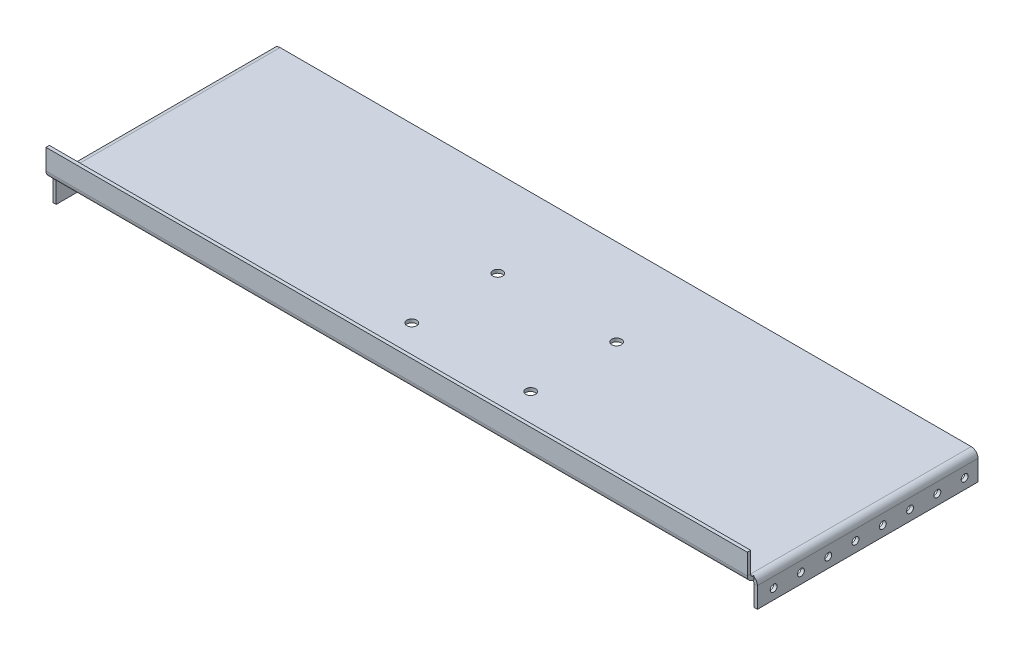
from build123d import *

# Parameters (mm, degrees)
SKETCH1_W                    = 489.688000048
SKETCH1_H                    = 177.8
BASE_FLANGE1_DEPTH           = 2.3622
EDGE_FLANGE1_STRIP_W         = 14.1688
EDGE_FLANGE1_STRIP_H         = 2.3622
EDGE_FLANGE1_STRIP_CUT_DEPTH = 489.688000048
EDGE_FLANGE1_DEPTH           = 489.688000048
EDGE_FLANGE2_STRIP_W         = 14.1688
EDGE_FLANGE2_STRIP_H         = 2.3622
EDGE_FLANGE2_STRIP_CUT_DEPTH = 173.0778
EDGE_FLANGE2_DEPTH           = 173.0778
EDGE_FLANGE3_STRIP_W         = 14.1688
EDGE_FLANGE3_STRIP_H         = 2.3622
EDGE_FLANGE3_STRIP_CUT_DEPTH = 173.0778
EDGE_FLANGE3_DEPTH           = 173.0778
SKETCH15_R                   = 3.4
CUT_EXTRUDE1_DEPTH           = 6.35
SKETCH33_W                   = 534.836919658
SKETCH33_H                   = 38.1
CUT_EXTRUDE5_DEPTH           = 264.395174273
SKETCH37_R                   = 2.413
CUT_EXTRUDE8_DEPTH           = 501.379367947


# Sheet-metal steps are written as plain solids
with BuildPart() as part:
    # Sketch1 → Base-Flange1 (new body)
    with BuildSketch(Plane(origin=(0, 0, 0), x_dir=(1, 0, 0), z_dir=(0, 1, 0))):
        Rectangle(SKETCH1_W, SKETCH1_H)
    extrude(amount=-BASE_FLANGE1_DEPTH)

    # Edge-Flange1 strip (across the edge) → Edge-Flange1 strip cut (cut)
    with BuildSketch(Plane(origin=(-244.844000024, 0, 88.9), x_dir=(0, 0, -1), z_dir=(1, 0, 0))):
        with Locations((-2.3622, -1.1811)):
            Rectangle(EDGE_FLANGE1_STRIP_W, EDGE_FLANGE1_STRIP_H)
    extrude(amount=EDGE_FLANGE1_STRIP_CUT_DEPTH, mode=Mode.SUBTRACT)

    # Edge-Flange1 section (across the edge) → Edge-Flange1 (add)
    with BuildSketch(Plane(origin=(-244.844000024, 0, 88.9), x_dir=(0, 0, -1), z_dir=(1, 0, 0))):
        with BuildLine():
            Line((0, 2.36), (0, 16.6878))
            Line((0, 16.6878), (2.3622, 16.6878))
            Line((2.3622, 16.6878), (2.3622, 2.36))
            ThreePointArc((2.3622, 2.36), (3.053427996, 0.691227996), (4.7222, 0))
            Line((4.7222, 0), (4.7222, -2.3622))
            ThreePointArc((4.7222, -2.3622), (1.383100358, -0.979099642), (0, 2.36))
        make_face()
    extrude(amount=EDGE_FLANGE1_DEPTH)

    # Edge-Flange2 strip (across the edge) → Edge-Flange2 strip cut (cut)
    with BuildSketch(Plane(origin=(-244.844000024, -2.3622, 84.1778), x_dir=(1, 0, 0), z_dir=(0, 0, -1))):
        with Locations((-2.3622, -1.1811)):
            Rectangle(EDGE_FLANGE2_STRIP_W, EDGE_FLANGE2_STRIP_H)
    extrude(amount=EDGE_FLANGE2_STRIP_CUT_DEPTH, mode=Mode.SUBTRACT)

    # Edge-Flange2 section (across the edge) → Edge-Flange2 (add)
    with BuildSketch(Plane(origin=(-244.844000024, -2.3622, 84.1778), x_dir=(1, 0, 0), z_dir=(0, 0, -1))):
        with BuildLine():
            Line((0, 2.36), (0, 16.6878))
            Line((0, 16.6878), (2.3622, 16.6878))
            Line((2.3622, 16.6878), (2.3622, 2.36))
            ThreePointArc((2.3622, 2.36), (3.053427996, 0.691227996), (4.7222, 0))
            Line((4.7222, 0), (4.7222, -2.3622))
            ThreePointArc((4.7222, -2.3622), (1.383100358, -0.979099642), (0, 2.36))
        make_face()
    extrude(amount=EDGE_FLANGE2_DEPTH)

    # Edge-Flange3 strip (across the edge) → Edge-Flange3 strip cut (cut)
    with BuildSketch(Plane(origin=(244.844000024, -2.3622, -88.9), x_dir=(-1, 0, 0), z_dir=(0, 0, 1))):
        with Locations((-4.7244, -1.1811)):
            Rectangle(EDGE_FLANGE3_STRIP_W, EDGE_FLANGE3_STRIP_H)
    extrude(amount=EDGE_FLANGE3_STRIP_CUT_DEPTH, mode=Mode.SUBTRACT)

    # Edge-Flange3 section (across the edge) → Edge-Flange3 (add)
    with BuildSketch(Plane(origin=(244.844000024, -2.3622, -88.9), x_dir=(-1, 0, 0), z_dir=(0, 0, 1))):
        with BuildLine():
            Line((-2.3622, 2.36), (-2.3622, 16.6878))
            Line((-2.3622, 16.6878), (0, 16.6878))
            Line((0, 16.6878), (0, 2.36))
            ThreePointArc((0, 2.36), (0.691227996, 0.691227996), (2.36, 0))
            Line((2.36, 0), (2.36, -2.3622))
            ThreePointArc((2.36, -2.3622), (-0.979099642, -0.979099642), (-2.3622, 2.36))
        make_face()
    extrude(amount=EDGE_FLANGE3_DEPTH)

    # Sketch15 → Cut-Extrude1 (cut)
    with BuildSketch(Plane(origin=(0, 0, 0), x_dir=(1, 0, 0), z_dir=(0, 1, 0))):
        with Locations(Location((-27.621800024, 9.3222, 0), (0, 0, 270))):
            Circle(SKETCH15_R)
        with Locations(Location((-27.621800024, -50.6778, 0), (0, 0, 270))):
            Circle(SKETCH15_R)
        with Locations(Location((55.378199976, 9.3222, 0), (0, 0, 270))):
            Circle(SKETCH15_R)
        with Locations(Location((55.378199976, -50.6778, 0), (0, 0, 270))):
            Circle(SKETCH15_R)
    extrude(amount=-CUT_EXTRUDE1_DEPTH, mode=Mode.SUBTRACT)

    # Sketch33 → Cut-Extrude5 (cut, through all)
    with BuildSketch(Plane(origin=(0, 0, 0), x_dir=(1, 0, 0), z_dir=(0, 1, 0))):
        with Locations((1.1811, 88.9)):
            Rectangle(SKETCH33_W, SKETCH33_H)
    extrude(amount=-CUT_EXTRUDE5_DEPTH, mode=Mode.SUBTRACT)

    # Sketch37 → Cut-Extrude8 (cut, through all)
    with BuildSketch(Plane.ZY.offset(244.844000024)):
        with Locations(Location((72.824, -11.8861, 0), (0, 0, 270))):
            Circle(SKETCH37_R)
        with Locations(Location((53.774, -11.8861, 0), (0, 0, 270))):
            Circle(SKETCH37_R)
        with Locations(Location((34.724, -11.8861, 0), (0, 0, 270))):
            Circle(SKETCH37_R)
        with Locations(Location((15.674, -11.8861, 0), (0, 0, 270))):
            Circle(SKETCH37_R)
        with Locations(Location((-3.376, -11.8861, 0), (0, 0, 270))):
            Circle(SKETCH37_R)
        with Locations(Location((-22.426, -11.8861, 0), (0, 0, 270))):
            Circle(SKETCH37_R)
        with Locations(Location((-41.476, -11.8861, 0), (0, 0, 270))):
            Circle(SKETCH37_R)
        with Locations(Location((-60.526, -11.8861, 0), (0, 0, 270))):
            Circle(SKETCH37_R)
    extrude(amount=-CUT_EXTRUDE8_DEPTH, mode=Mode.SUBTRACT)


solid = part.part
